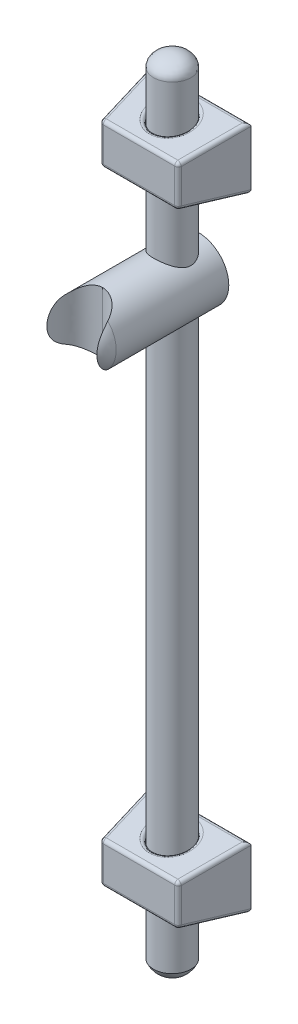
from build123d import *

# Parameters (mm, degrees)
SKETCH1_W                     = 80
SKETCH1_H                     = 50
BOSS_EXTRUDE1_DEPTH           = 50
BOSS_EXTRUDE1_DRAFT           = 10
BOSS_EXTRUDE1_PROFILE_2_DEPTH = 50
BOSS_EXTRUDE1_PROFILE_2_DRAFT = 10
SKETCH2_R                     = 15
CUT_EXTRUDE1_DEPTH            = 580
SKETCH2_2_R                   = 15
BOSS_EXTRUDE3_DEPTH           = 540
SKETCH7_R                     = 15
BOSS_EXTRUDE4_DEPTH           = 80
CUT_EXTRUDE3_DEPTH            = 25
DOME1_FACE_RADIUS             = 15
DOME1_HEIGHT                  = 10
DOME2_FACE_RADIUS             = 15
DOME2_HEIGHT                  = 10
FILLET1_R                     = 3
FILLET2_R                     = 3


with BuildPart() as part:
    # Sketch1 → Boss-Extrude1 (with draft: the straight prism first)
    with BuildSketch(Plane.XY):
        with Locations((0, -475)):
            Rectangle(SKETCH1_W, SKETCH1_H)
    extrude(amount=BOSS_EXTRUDE1_DEPTH)
    # Boss-Extrude1: the draft: its side faces are tilted about the plane it starts from
    boss_extrude1_sides = [part.faces().sort_by_distance(p)[0] for p in [
        (0, -500, 25),
        (40, -475, 25),
        (0, -450, 25),
        (-40, -475, 25),
    ]]
    draft(boss_extrude1_sides, Plane.XY, BOSS_EXTRUDE1_DRAFT)


with BuildPart() as body_2:
    # Sketch1 → Boss-Extrude1 profile 2 (with draft: the straight prism first)
    with BuildSketch(Plane.XY):
        with Locations((0, 25)):
            Rectangle(SKETCH1_W, SKETCH1_H)
    extrude(amount=BOSS_EXTRUDE1_PROFILE_2_DEPTH)
    # Boss-Extrude1 profile 2: the draft: its side faces are tilted about the plane it starts from
    boss_extrude1_profile_2_sides = [body_2.faces().sort_by_distance(p)[0] for p in [
        (0, 0, 25),
        (40, 25, 25),
        (0, 50, 25),
        (-40, 25, 25),
    ]]
    draft(boss_extrude1_profile_2_sides, Plane.XY, BOSS_EXTRUDE1_PROFILE_2_DRAFT)


with BuildPart() as cut_extrude1_tool:
    # Sketch2 → Cut-Extrude1 (new, symmetric)
    with BuildSketch(Plane(origin=(0, 0, 0), x_dir=(1, 0, 0), z_dir=(0, 1, 0))):
        with Locations(Location((0, -23.296999592, 0), (0, 0, 270))):
            Circle(SKETCH2_R)
    extrude(amount=CUT_EXTRUDE1_DEPTH, both=True)


with BuildPart() as part_1:
    add(part.part)

    # Cut-Extrude1: cut by cut_extrude1_tool
    add(cut_extrude1_tool.part, mode=Mode.SUBTRACT)

    # Fillet2
    fillet2_edges = [part_1.edges().sort_by_distance(p)[0] for p in [
        (0, -491.183650965, 50),
        (31.183650965, -475, 50),
        (1.2e-06, -451.462984887, 8.296999592),
        (-1.2e-06, -498.537015113, 8.296999592),
        (0, -458.816349035, 50),
        (0, -500, 0),
        (0, -450, 0),
        (-31.183650965, -475, 50),
        (35.591825482, -454.408174518, 25),
        (35.591825482, -495.591825482, 25),
        (-35.591825482, -495.591825482, 25),
        (-35.591825482, -454.408174518, 25),
    ]]
    fillet(fillet2_edges, radius=FILLET2_R)


with BuildPart() as body_2_1:
    add(body_2.part)

    # Cut-Extrude1: cut by cut_extrude1_tool
    add(cut_extrude1_tool.part, mode=Mode.SUBTRACT)

    # Fillet1
    fillet1_edges = [body_2_1.edges().sort_by_distance(p)[0] for p in [
        (-1.2e-06, 1.462984887, 8.296999592),
        (1.2e-06, 48.537015113, 8.296999592),
        (0, 50, 0),
        (0, 0, 0),
        (-31.183650965, 25, 50),
        (0, 41.183650965, 50),
        (31.183650965, 25, 50),
        (0, 8.816349035, 50),
        (-35.591825482, 45.591825482, 25),
        (35.591825482, 45.591825482, 25),
        (35.591825482, 4.408174518, 25),
        (-35.591825482, 4.408174518, 25),
    ]]
    fillet(fillet1_edges, radius=FILLET1_R)


with BuildPart() as body_3:
    # Sketch2<2> → Boss-Extrude3 (new body)
    with BuildSketch(Plane(origin=(0, 0, 0), x_dir=(1, 0, 0), z_dir=(0, 1, 0))):
        with Locations(Location((0, -23.296999592, 0), (0, 0, 270))):
            Circle(SKETCH2_2_R)
    extrude(amount=-BOSS_EXTRUDE3_DEPTH)

    # Sketch3 → Revolve1 (revolve)
    with BuildSketch(Plane(origin=(0, -70, 0), x_dir=(1, 0, 0), z_dir=(0, 1, 0))):
        with BuildLine():
            Line((0, -110.822071397), (0, -8.296999592))
            Line((0, -8.296999592), (0, -2.388308338))
            Line((0, -2.388308338), (24.467996396, -2.388308338))
            Line((24.467996396, -2.388308338), (24.467996396, -8.296999592))
            Line((24.467996396, -8.296999592), (24.467996396, -92.780880421))
            ThreePointArc((24.467996396, -92.780880421), (16.389158538, -107.436827165), (0, -110.822071397))
        make_face()
    revolve(axis=Axis((0, -70, 195.959992578), (0, 0, -1)))

    # Sketch6 → Cut-Extrude3 (cut, symmetric)
    with BuildSketch(Plane(origin=(0, -70, 0), x_dir=(1, 0, 0), z_dir=(0, 1, 0))):
        with BuildLine():
            Line((0, -122.921814065), (-20, -122.921814065))
            add(Edge.make_bspline(
                [(-20, -122.921814065), (-23.553263932, -79.927243328), (0, -79.133002022)],
                knots=[0, 0, 0, 0.967849863, 0.967849863, 0.967849863], degree=2))
            add(Edge.make_bspline(
                [(20, -122.921814065), (23.553263932, -79.927243328), (0, -79.133002022)],
                knots=[0, 0, 0, 0.967849863, 0.967849863, 0.967849863], degree=2))
            Line((20, -122.921814065), (0, -122.921814065))
        make_face()
    extrude(amount=CUT_EXTRUDE3_DEPTH, both=True, mode=Mode.SUBTRACT)

    # Dome1: a dome of height H over a round flat face of radius A is a cap of a sphere of radius (A * A + H * H) / (2 * H)
    dome1_r = (DOME1_FACE_RADIUS * DOME1_FACE_RADIUS + DOME1_HEIGHT * DOME1_HEIGHT) / (2 * DOME1_HEIGHT)
    dome1_base = Plane((0, -540, 23.296999592), z_dir=(0, -1, 0))
    with Locations(dome1_base.offset(DOME1_HEIGHT - dome1_r)):
        dome1_ball = Sphere(dome1_r, mode=Mode.PRIVATE)
    add(split(dome1_ball, bisect_by=dome1_base, keep=Keep.TOP, mode=Mode.PRIVATE))


with BuildPart() as body_4:
    # Sketch7 → Boss-Extrude4 (new body)
    with BuildSketch(Plane(origin=(0, 0, 0), x_dir=(1, 0, 0), z_dir=(0, 1, 0))):
        with Locations(Location((0, -23.296999592, 0), (0, 0, 270))):
            Circle(SKETCH7_R)
    extrude(amount=BOSS_EXTRUDE4_DEPTH)

    # Dome2: an elliptical dome of height H over a round flat face of radius A is half a spheroid: the quarter ellipse of half axes A and H revolved about the face's axis
    with BuildSketch(Plane((0, 80, 23.296999592), x_dir=(0, 0, -1), z_dir=(1, 0, 0)), mode=Mode.PRIVATE) as dome2_quarter:
        Ellipse(DOME2_FACE_RADIUS, DOME2_HEIGHT)
        Rectangle(DOME2_FACE_RADIUS, DOME2_HEIGHT, align=(Align.MIN, Align.MIN), mode=Mode.INTERSECT)
    revolve(dome2_quarter.sketch, axis=Axis((0, 80, 23.296999592), (0, 1, 0)))


solid = Compound([part_1.part, body_2_1.part, body_3.part, body_4.part])
